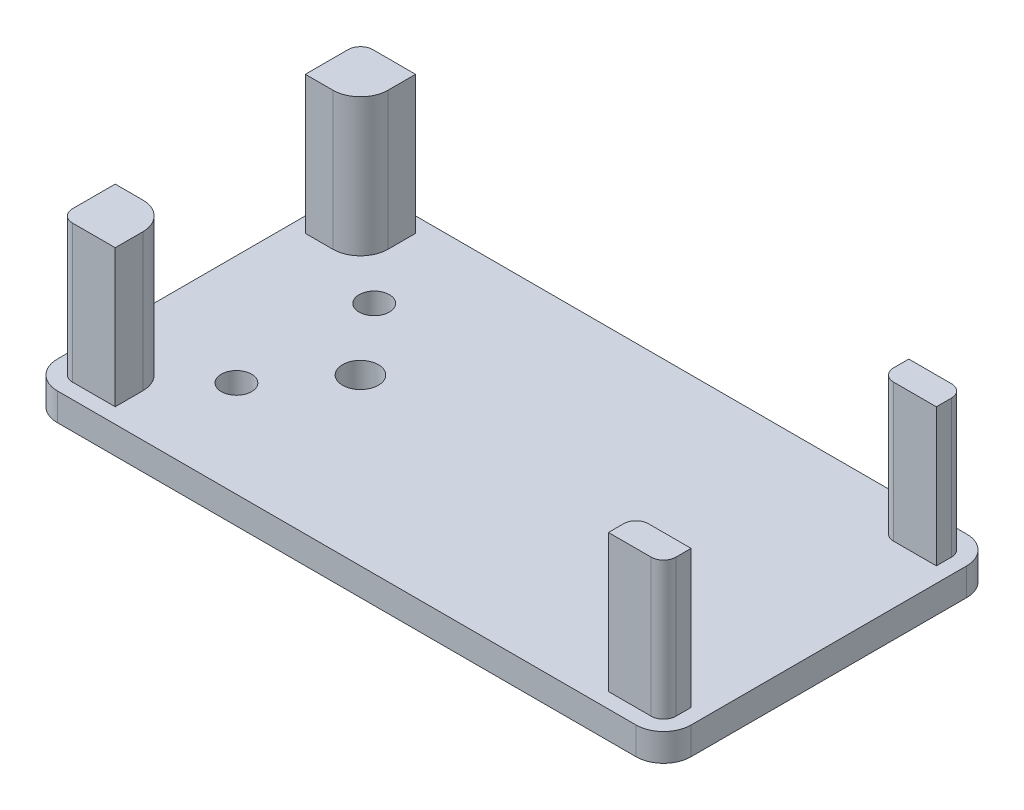
from build123d import *

# Parameters (mm, degrees)
SKETCH1_W           = 111.76
SKETCH1_H           = 60.96
BOSS_EXTRUDE1_DEPTH = 5.08
FILLET1_R           = 5.08
CUT_EXTRUDE1_REACH  = 129.406
SKETCH3_R           = 2.794
SKETCH3_R_2         = 3.302
SKETCH5_W           = 10.16
SKETCH5_H           = 60.96
BOSS_EXTRUDE2_DEPTH = 5.08
FILLET2_R           = 5.08
SKETCH2_W           = 10.16
SKETCH2_H           = 10.16
SKETCH2_H_2         = 5.08
BOSS_EXTRUDE5_DEPTH = 25.4
FILLET9_R           = 2.286
FILLET10_R          = 5.08


with BuildPart() as part:
    # Sketch1 → Boss-Extrude1 (new body)
    with BuildSketch(Plane(origin=(0, 0, 0), x_dir=(1, 0, 0), z_dir=(0, 1, 0))):
        with Locations((55.88, 30.48)):
            Rectangle(SKETCH1_W, SKETCH1_H)
    extrude(amount=BOSS_EXTRUDE1_DEPTH)

    # Fillet1
    fillet1_edges = [part.edges().sort_by_distance(p)[0] for p in [
        (0, 2.54, -60.96),
        (111.76, 2.54, -60.96),
        (111.76, 2.54, 0),
        (0, 2.54, 0),
    ]]
    fillet(fillet1_edges, radius=FILLET1_R)

    # Sketch3 → Cut-Extrude1 (cut, up to next)
    with BuildSketch(Plane.XZ, mode=Mode.PRIVATE) as cut_extrude1_sk1:
        with Locations((20.32, -17.78)):
            Circle(SKETCH3_R)
    cut_extrude1_tool1 = extrude(cut_extrude1_sk1.sketch, amount=-CUT_EXTRUDE1_REACH, mode=Mode.PRIVATE) & part.part
    # Sketch3 → Cut-Extrude1 (cut, up to next)
    with BuildSketch(Plane.XZ, mode=Mode.PRIVATE) as cut_extrude1_sk2:
        with Locations((20.32, -43.18)):
            Circle(SKETCH3_R)
    cut_extrude1_tool2 = extrude(cut_extrude1_sk2.sketch, amount=-CUT_EXTRUDE1_REACH, mode=Mode.PRIVATE) & part.part
    # Sketch3 → Cut-Extrude1 (cut, up to next)
    with BuildSketch(Plane.XZ, mode=Mode.PRIVATE) as cut_extrude1_sk3:
        with Locations((30.48, -30.48)):
            Circle(SKETCH3_R_2)
    cut_extrude1_tool3 = extrude(cut_extrude1_sk3.sketch, amount=-CUT_EXTRUDE1_REACH, mode=Mode.PRIVATE) & part.part
    add(cut_extrude1_tool1.solids().sort_by_distance((20.32, 0, -17.78))[0], mode=Mode.SUBTRACT)
    add(cut_extrude1_tool2.solids().sort_by_distance((20.32, 0, -43.18))[0], mode=Mode.SUBTRACT)
    add(cut_extrude1_tool3.solids().sort_by_distance((30.48, 0, -30.48))[0], mode=Mode.SUBTRACT)

    # Sketch5 → Boss-Extrude2 (add)
    with BuildSketch(Plane.XZ):
        with Locations((111.76, -30.48)):
            Rectangle(SKETCH5_W, SKETCH5_H)
    extrude(amount=-BOSS_EXTRUDE2_DEPTH)

    # Fillet2
    fillet2_edges = [part.edges().sort_by_distance(p)[0] for p in [
        (116.84, 2.54, -60.96),
        (116.84, 2.54, 0),
    ]]
    fillet(fillet2_edges, radius=FILLET2_R)

    # Sketch2 → Boss-Extrude5 (add)
    with BuildSketch(Plane(origin=(0, 5.08, 0), x_dir=(1, 0, 0), z_dir=(0, 1, 0))):
        with Locations((7.874, 53.086)):
            Rectangle(SKETCH2_W, SKETCH2_H)
        with Locations((7.874, 7.874)):
            Rectangle(SKETCH2_W, SKETCH2_H)
        with Locations((108.966, 55.626)):
            Rectangle(SKETCH2_W, SKETCH2_H_2)
        with Locations((108.966, 5.334)):
            Rectangle(SKETCH2_W, SKETCH2_H_2)
    extrude(amount=BOSS_EXTRUDE5_DEPTH)

    # Fillet9
    fillet9_edges = [part.edges().sort_by_distance(p)[0] for p in [
        (114.046, 17.78, -2.794),
        (103.886, 17.78, -7.874),
        (114.046, 17.78, -58.166),
        (103.886, 17.78, -53.086),
        (2.794, 17.78, -2.794),
        (2.794, 17.78, -58.166),
    ]]
    fillet(fillet9_edges, radius=FILLET9_R)

    # Fillet10
    fillet10_edges = [part.edges().sort_by_distance(p)[0] for p in [
        (12.954, 17.78, -12.954),
        (12.954, 17.78, -48.006),
    ]]
    fillet(fillet10_edges, radius=FILLET10_R)


solid = part.part
